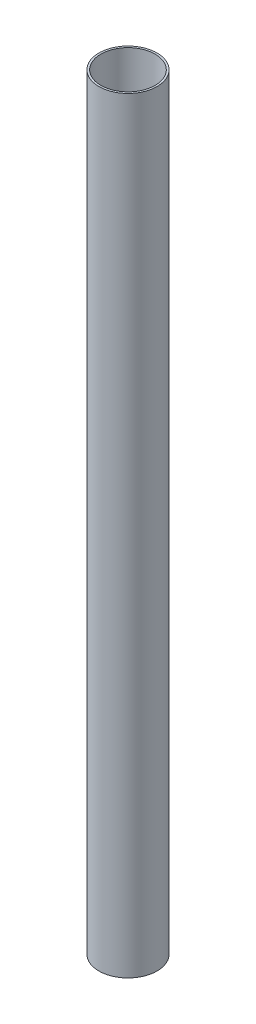
from build123d import *

# Parameters (mm, degrees)
SKETCH1_W = 1.9304
SKETCH1_H = 762


with BuildPart() as part:
    # Sketch1 → Revolve1 (revolve)
    with BuildSketch(Plane.XY):
        with Locations((27.9527, -387.262908014)):
            Rectangle(SKETCH1_W, SKETCH1_H)
    revolve(axis=Axis((0, 0, 0), (0, -1, 0)))


solid = part.part
